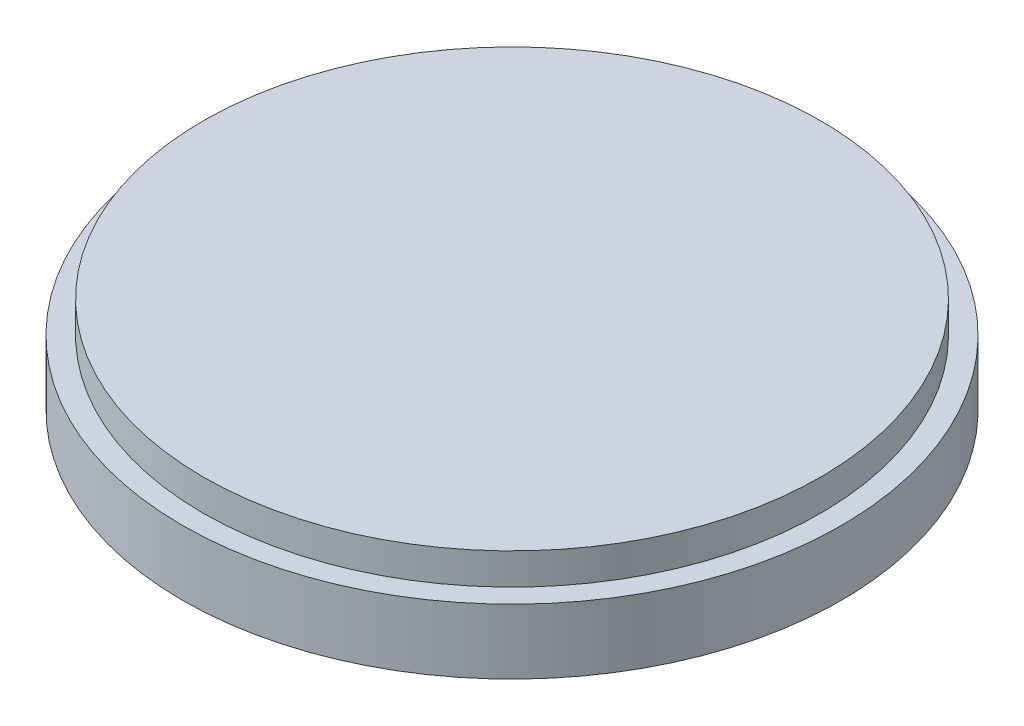
from build123d import *

# Parameters (mm, degrees)
M3_CLEARANCE_HOLE1_D     = 3.4
M3_CLEARANCE_HOLE1_DEPTH = 4
M3_CLEARANCE_HOLE1_TIP   = 1.021463052
SKETCH5_R                = 29.5
BOSS_EXTRUDE1_DEPTH      = 3


with BuildPart() as part:
    # Sketch1 → Revolve1 (revolve)
    with BuildSketch(Plane.XY):
        Polygon((-26.5, -7.6), (-31.5, -6.2), (-31.5, 0), (0, 0), (0, -7.6), align=None)
    revolve(axis=Axis((0, -13.2, 0), (0, 1, 0)))

    # M3 Clearance Hole1
    with Locations(Plane(origin=(0, -7.6, 0), x_dir=(-1, 0, 0), z_dir=(0, -1, 0))):
        with Locations((15.556349186, -15.556349186), (15.556349186, 15.556349186), (-15.556349186, 15.556349186), (-15.556349186, -15.556349186)):
            Hole(M3_CLEARANCE_HOLE1_D / 2, depth=M3_CLEARANCE_HOLE1_DEPTH)
            with Locations((0, 0, -(M3_CLEARANCE_HOLE1_DEPTH + M3_CLEARANCE_HOLE1_TIP / 2))):  # 118° drill point
                Cone(0, M3_CLEARANCE_HOLE1_D / 2, M3_CLEARANCE_HOLE1_TIP, mode=Mode.SUBTRACT)

    # Sketch5 → Boss-Extrude1 (add)
    with BuildSketch(Plane(origin=(0, 0, 0), x_dir=(1, 0, 0), z_dir=(0, 1, 0))):
        Circle(SKETCH5_R)
    extrude(amount=BOSS_EXTRUDE1_DEPTH)


solid = part.part
